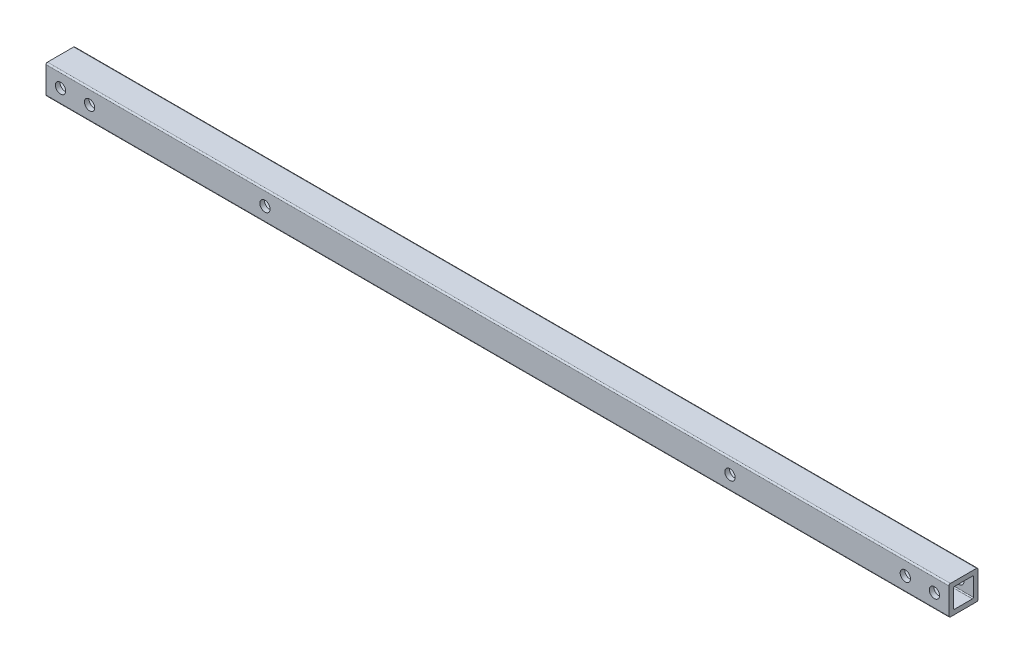
from build123d import *

# Parameters (mm, degrees)
BOSS_EXTRUDE1_DEPTH              = 295.91
F_1_4_CLEARANCE_HOLE1_AT_2_COUNT = 2
F_1_4_CLEARANCE_HOLE1_AT_2_PITCH = 31.75
F_1_4_CLEARANCE_HOLE1_AT_3_COUNT = 2
F_1_4_CLEARANCE_HOLE1_AT_3_PITCH = 50.8
F_1_4_CLEARANCE_HOLE1_AT_4_COUNT = 2
F_1_4_CLEARANCE_HOLE1_AT_4_PITCH = 165.735


with BuildPart() as part:
    # Sketch4 → Boss-Extrude1 (new, symmetric)
    with BuildSketch(Plane(origin=(0, 0, 0), x_dir=(0, 0, -1), z_dir=(1, 0, 0))):
        with BuildLine():
            Line((9.525, -8.5725), (9.525, 8.5725))
            ThreePointArc((9.525, 8.5725), (9.246019209, 9.246019209), (8.5725, 9.525))
            Line((8.5725, 9.525), (-8.5725, 9.525))
            ThreePointArc((-8.5725, 9.525), (-9.246019209, 9.246019209), (-9.525, 8.5725))
            Line((-9.525, 8.5725), (-9.525, -8.5725))
            ThreePointArc((-9.525, -8.5725), (-9.246019209, -9.246019209), (-8.5725, -9.525))
            Line((-8.5725, -9.525), (8.5725, -9.525))
            ThreePointArc((8.5725, -9.525), (9.246019209, -9.246019209), (9.525, -8.5725))
        make_face()
        with BuildLine():
            Line((6.477, 5.8293), (6.477, -5.8293))
            ThreePointArc((6.477, -5.8293), (6.287293062, -6.287293062), (5.8293, -6.477))
            Line((5.8293, -6.477), (-5.8293, -6.477))
            ThreePointArc((-5.8293, -6.477), (-6.287293062, -6.287293062), (-6.477, -5.8293))
            Line((-6.477, -5.8293), (-6.477, 5.8293))
            ThreePointArc((-6.477, 5.8293), (-6.287293062, 6.287293062), (-5.8293, 6.477))
            Line((-5.8293, 6.477), (5.8293, 6.477))
            ThreePointArc((5.8293, 6.477), (6.287293062, 6.287293062), (6.477, 5.8293))
        make_face(mode=Mode.SUBTRACT)
    extrude(amount=BOSS_EXTRUDE1_DEPTH, both=True)

    # Sketch6 → 1/4 Clearance Hole1 (revolve, cut)
    with BuildSketch(Plane(origin=(318.135, 0, -9.525), x_dir=(0, 1, 0), z_dir=(1, 0, 0))):
        Polygon((0, 0), (0, 21.079827343), (3.3782, 19.05), (3.3782, 0), align=None)
    f_1_4_clearance_hole1 = revolve(axis=Axis((318.135, 0, -15.875), (0, 0, 1)), mode=Mode.SUBTRACT)

    # 1/4 Clearance Hole1 at 2: 1/4 Clearance Hole1 ×2
    with Locations(*[(-i * F_1_4_CLEARANCE_HOLE1_AT_2_PITCH, 0, 0) for i in range(1, F_1_4_CLEARANCE_HOLE1_AT_2_COUNT)]):
        add(f_1_4_clearance_hole1, mode=Mode.SUBTRACT)

    # 1/4 Clearance Hole1 at 3: 1/4 Clearance Hole1 ×2
    with Locations(*[(-i * F_1_4_CLEARANCE_HOLE1_AT_3_PITCH, 0, 0) for i in range(1, F_1_4_CLEARANCE_HOLE1_AT_3_COUNT)]):
        add(f_1_4_clearance_hole1, mode=Mode.SUBTRACT)

    # 1/4 Clearance Hole1 at 4: 1/4 Clearance Hole1 ×2
    with Locations(*[(-i * F_1_4_CLEARANCE_HOLE1_AT_4_PITCH, 0, 0) for i in range(1, F_1_4_CLEARANCE_HOLE1_AT_4_COUNT)]):
        add(f_1_4_clearance_hole1, mode=Mode.SUBTRACT)

    # Mirror2: 1/4 Clearance Hole1 across plane
    add(f_1_4_clearance_hole1.mirror(Plane(origin=(0, 0, 0), x_dir=(0, 0, 1), z_dir=(1, 0, 0))), mode=Mode.SUBTRACT)

    # Mirror2 copy 1 sketch → Mirror2 copy 1 (revolve, cut)
    with BuildSketch(Plane(origin=(-286.385, 0, -9.525), x_dir=(0, 1, 0), z_dir=(-1, 0, 0))):
        Polygon((0, 0), (0, -21.079827343), (3.3782, -19.05), (3.3782, 0), align=None)
    revolve(axis=Axis((-286.385, 0, -15.875), (0, 0, -1)), mode=Mode.SUBTRACT)

    # Mirror2 copy 2 sketch → Mirror2 copy 2 (revolve, cut)
    with BuildSketch(Plane(origin=(-267.335, 0, -9.525), x_dir=(0, 1, 0), z_dir=(-1, 0, 0))):
        Polygon((0, 0), (0, -21.079827343), (3.3782, -19.05), (3.3782, 0), align=None)
    revolve(axis=Axis((-267.335, 0, -15.875), (0, 0, -1)), mode=Mode.SUBTRACT)

    # Mirror2 copy 3 sketch → Mirror2 copy 3 (revolve, cut)
    with BuildSketch(Plane(origin=(-152.4, 0, -9.525), x_dir=(0, 1, 0), z_dir=(-1, 0, 0))):
        Polygon((0, 0), (0, -21.079827343), (3.3782, -19.05), (3.3782, 0), align=None)
    revolve(axis=Axis((-152.4, 0, -15.875), (0, 0, -1)), mode=Mode.SUBTRACT)


solid = part.part
